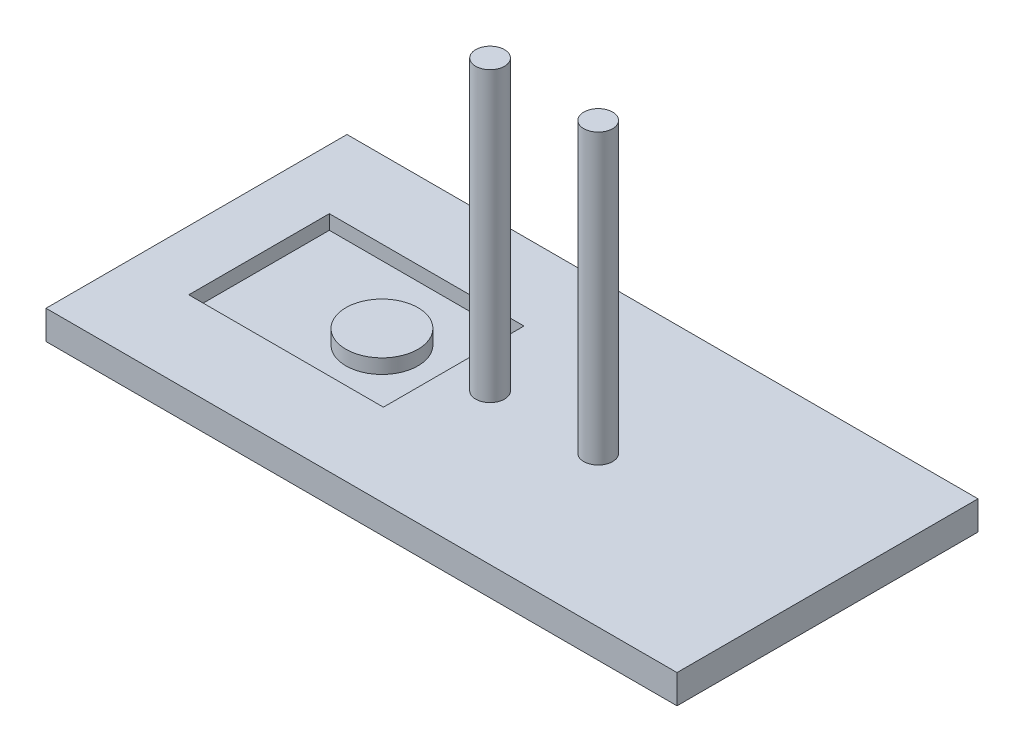
from build123d import *

# Parameters (mm, degrees)
SKETCH2_W           = 87.535593736
SKETCH2_H           = 41.754052132
BOSS_EXTRUDE1_DEPTH = 4
SKETCH1_R           = 2
BOSS_EXTRUDE2_DEPTH = 40
SKETCH1_3_W         = 27
SKETCH1_3_H         = 19.5
SKETCH1_3_R         = 5
CUT_EXTRUDE1_DEPTH  = 2


with BuildPart() as part:
    # Sketch2 → Boss-Extrude1 (new body)
    with BuildSketch(Plane(origin=(0, 0, 0), x_dir=(1, 0, 0), z_dir=(0, 1, 0))):
        Rectangle(SKETCH2_W, SKETCH2_H)
    extrude(amount=-BOSS_EXTRUDE1_DEPTH)

    # Sketch1 → Boss-Extrude2 (add)
    with BuildSketch(Plane(origin=(0, 0, 0), x_dir=(1, 0, 0), z_dir=(0, 1, 0))):
        with Locations((11.961031396, 0)):
            Circle(SKETCH1_R)
        with Locations((-3.038968604, 0)):
            Circle(SKETCH1_R)
    extrude(amount=BOSS_EXTRUDE2_DEPTH)

    # Sketch1<3> → Cut-Extrude1 (cut)
    with BuildSketch(Plane(origin=(0, 0, 0), x_dir=(1, 0, 0), z_dir=(0, 1, 0))):
        with Locations((-21.979059056, 0.389527317)):
            Rectangle(SKETCH1_3_W, SKETCH1_3_H)
        with Locations((-18.038968604, 0)):
            Circle(SKETCH1_3_R, mode=Mode.SUBTRACT)
    extrude(amount=-CUT_EXTRUDE1_DEPTH, mode=Mode.SUBTRACT)


solid = part.part
